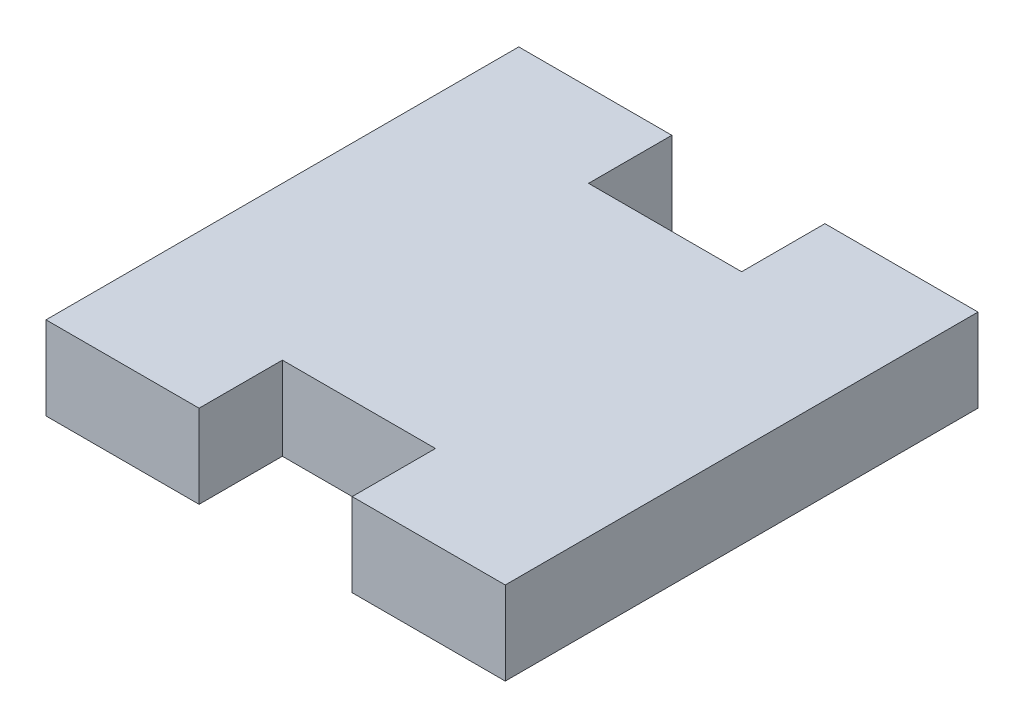
from build123d import *

# Parameters (mm, degrees)
SKETCH1_W           = 30
SKETCH1_H           = 30.88
BOSS_EXTRUDE1_DEPTH = 5.44
CAVITY1_START       = 10
CAVITY1_OUTLINE_W   = 5.44
CAVITY1_OUTLINE_H   = 5.44
CAVITY1_DEPTH       = 10


# Read off the part's stored shape, not the designer's step: Cavity1
with BuildPart() as part:
    # Sketch1 → Boss-Extrude1 (new body)
    with BuildSketch(Plane(origin=(0, 0, 0), x_dir=(1, 0, 0), z_dir=(0, 1, 0))):
        with Locations((15, 15.44)):
            Rectangle(SKETCH1_W, SKETCH1_H)
    extrude(amount=BOSS_EXTRUDE1_DEPTH)

    # Cavity1 outline → Cavity1 (cut)
    with BuildSketch(Plane.YZ.offset(CAVITY1_START)):
        with Locations((2.72, -28.16)):
            Rectangle(CAVITY1_OUTLINE_W, CAVITY1_OUTLINE_H)
        with Locations((2.72, -2.72)):
            Rectangle(CAVITY1_OUTLINE_W, CAVITY1_OUTLINE_H)
    extrude(amount=CAVITY1_DEPTH, mode=Mode.SUBTRACT)


solid = part.part
